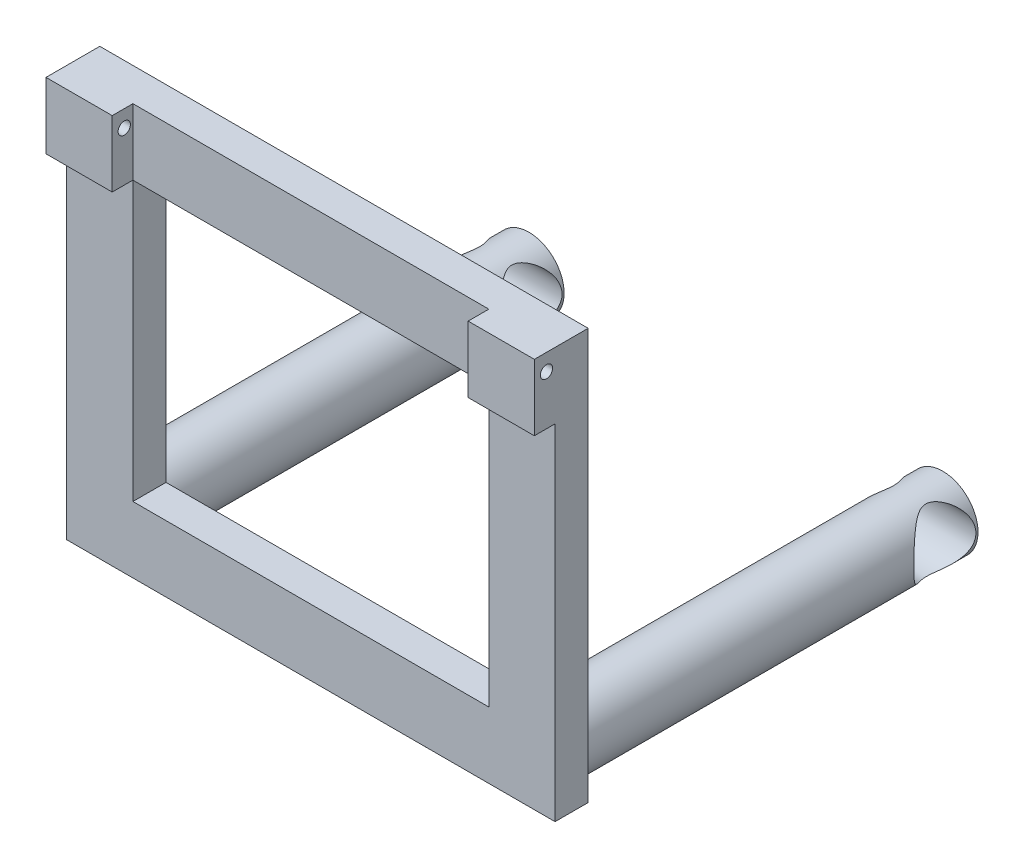
from build123d import *

# Parameters (mm, degrees)
SKETCH1_W               = 1180.071112
SKETCH1_H               = 992.574724554
SKETCH1_W_2             = 860.071112
SKETCH1_H_2             = 672.574724554
BOSS_EXTRUDE2_DEPTH     = 80
SKETCH2_W               = 160
SKETCH2_H               = 160
BOSS_EXTRUDE3_DEPTH     = 50
CUT_EXTRUDE1_DEPTH      = 1455.1049711
CUT_EXTRUDE1_DEPTH_BACK = 1455.1049711
SKETCH3_R               = 14.854674555
SKETCH4_R               = 85
BOSS_EXTRUDE4_DEPTH     = 947
SKETCH5_R               = 75
CUT_EXTRUDE2_DEPTH      = 1738.248309603


with BuildPart() as part:
    # Sketch1 → Boss-Extrude2 (new body)
    with BuildSketch(Plane.XY):
        with Locations((-366.347627568, -343.327690947)):
            Rectangle(SKETCH1_W, SKETCH1_H)
        with Locations((-366.347627568, -343.327690947)):
            Rectangle(SKETCH1_W_2, SKETCH1_H_2, mode=Mode.SUBTRACT)
    extrude(amount=BOSS_EXTRUDE2_DEPTH)

    # Sketch2 → Boss-Extrude3 (add)
    with BuildSketch(Plane.XY.offset(80)):
        with Locations((-876.383183568, 72.95967133)):
            Rectangle(SKETCH2_W, SKETCH2_H)
        with Locations((143.687928432, 72.95967133)):
            Rectangle(SKETCH2_W, SKETCH2_H)
    extrude(amount=BOSS_EXTRUDE3_DEPTH)

    # Sketch3 → Cut-Extrude1 (cut, two sides: drawn at the far end of the back side and taken through both)
    with BuildSketch(Plane(origin=(223.687928432, 0, 0), x_dir=(0, 0, -1), z_dir=(1, 0, 0)).offset(-CUT_EXTRUDE1_DEPTH_BACK)):
        with Locations((-100.843841858, 112.404893927)):
            Circle(SKETCH3_R)
    extrude(amount=CUT_EXTRUDE1_DEPTH + CUT_EXTRUDE1_DEPTH_BACK, mode=Mode.SUBTRACT)

    # Sketch4 → Boss-Extrude4 (add)
    with BuildSketch(Plane(origin=(0, 0, 0), x_dir=(-1, 0, 0), z_dir=(0, 0, -1))):
        with Locations((-133.687928432, -749.615053224)):
            Circle(SKETCH4_R)
        with Locations((866.383183568, -749.615053224)):
            Circle(SKETCH4_R)
    extrude(amount=BOSS_EXTRUDE4_DEPTH)

    # Sketch5 → Cut-Extrude2 (cut, through all)
    with BuildSketch(Plane(origin=(233.687928432, 0, 0), x_dir=(0, 0, -1), z_dir=(1, 0, 0))):
        with Locations((867, -748.910486991)):
            Circle(SKETCH5_R)
    extrude(amount=-CUT_EXTRUDE2_DEPTH, mode=Mode.SUBTRACT)


solid = part.part
